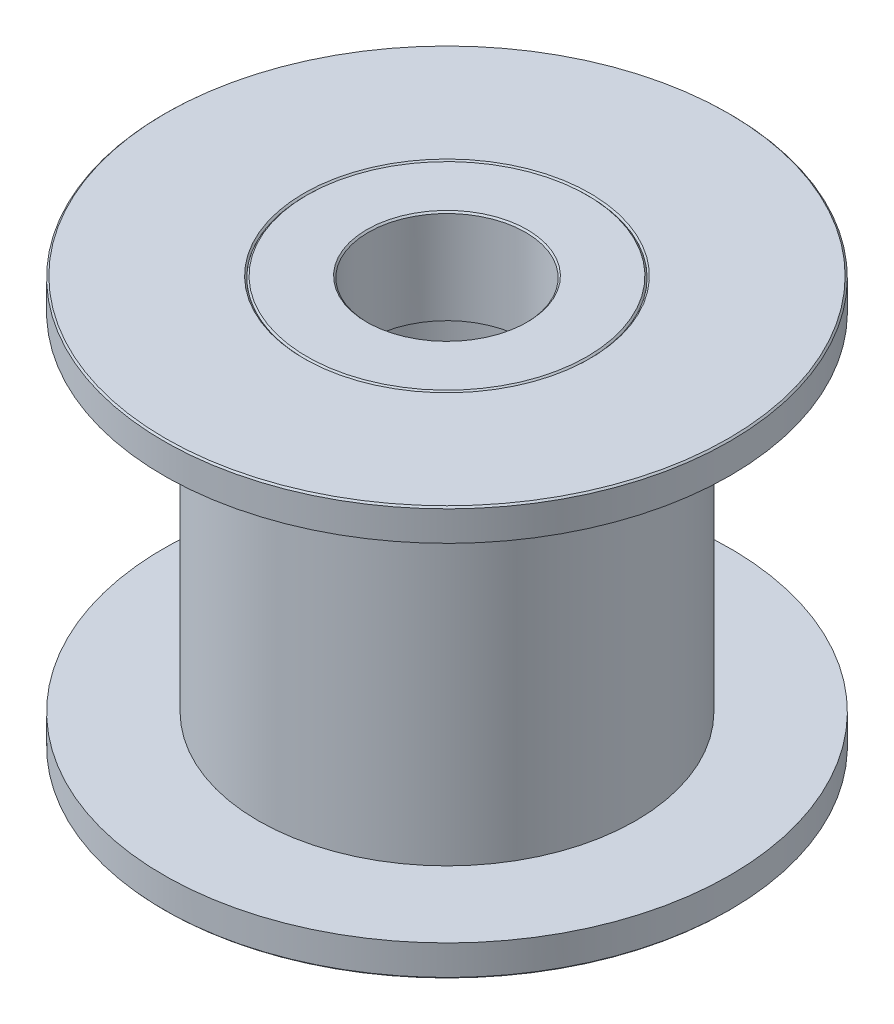
from build123d import *

# Parameters (mm, degrees)
CHAMFER1_SIZE = 0.05
SKETCH1_3_W   = 2
SKETCH1_3_H   = 3
CHAMFER2_SIZE = 0.05
CHAMFER3_SIZE = 0.05


with BuildPart() as part:
    # Sketch1 → Revolve1 (revolve)
    with BuildSketch(Plane.XY):
        Polygon((6, -7.575803982), (6, 3.424196018), (9, 3.424196018), (9, 4.424196018), (4.5, 4.424196018), (4.5, 1.424196018), (3.5, 1.424196018), (3.5, -5.575803982), (4.5, -5.575803982), (4.5, -8.575803982), (9, -8.575803982), (9, -7.575803982), align=None)
    revolve(axis=Axis((0, -12.88820827, 0), (0, 1, 0)))

    # Chamfer1
    chamfer1_edges = [part.edges().sort_by_distance(p)[0] for p in [
        (-4.5, -8.575803982, 0),
        (-4.5, 4.424196018, 0),
        (-9, 4.424196018, 0),
        (-9, -8.575803982, 0),
    ]]
    chamfer(chamfer1_edges, length=CHAMFER1_SIZE)


with BuildPart() as body_2:
    # Sketch1<3> → Revolve2 (revolve)
    with BuildSketch(Plane.XY):
        with Locations((3.5, 2.924196018)):
            Rectangle(SKETCH1_3_W, SKETCH1_3_H)
        with Locations((3.5, -7.075803982)):
            Rectangle(SKETCH1_3_W, SKETCH1_3_H)
    revolve(axis=Axis((0, -12.88820827, 0), (0, 1, 0)))

    # Chamfer2
    chamfer2_edges = [body_2.edges().sort_by_distance(p)[0] for p in [
        (-4.5, -8.575803982, 0),
        (-2.5, -8.575803982, 0),
    ]]
    chamfer(chamfer2_edges, length=CHAMFER2_SIZE)

    # Chamfer3
    chamfer3_edges = [body_2.edges().sort_by_distance(p)[0] for p in [
        (-4.5, 4.424196018, 0),
        (-2.5, 4.424196018, 0),
    ]]
    chamfer(chamfer3_edges, length=CHAMFER3_SIZE)


solid = Compound([part.part, body_2.part])
